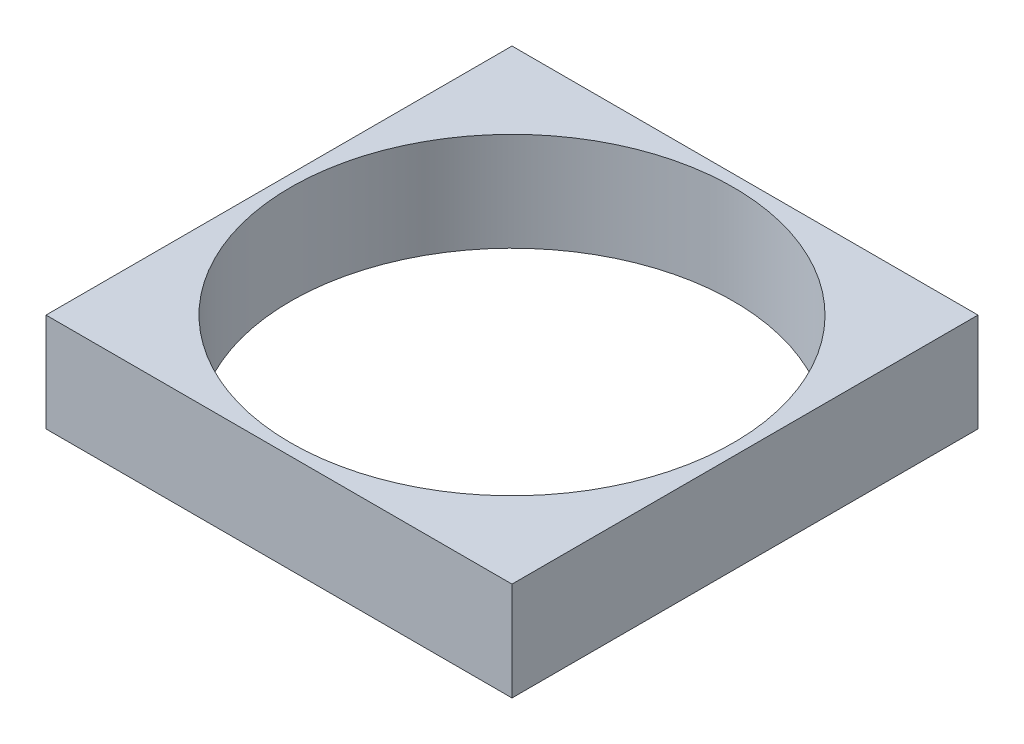
from build123d import *

# Parameters (mm, degrees)
SKETCH2_W           = 120
SKETCH2_H           = 120
SKETCH2_R           = 57
BOSS_EXTRUDE1_DEPTH = 25.4


with BuildPart() as part:
    # Sketch2 → Boss-Extrude1 (new body)
    with BuildSketch(Plane(origin=(0, 0, 0), x_dir=(1, 0, 0), z_dir=(0, 1, 0))):
        Rectangle(SKETCH2_W, SKETCH2_H)
        Circle(SKETCH2_R, mode=Mode.SUBTRACT)
    extrude(amount=BOSS_EXTRUDE1_DEPTH)


solid = part.part
